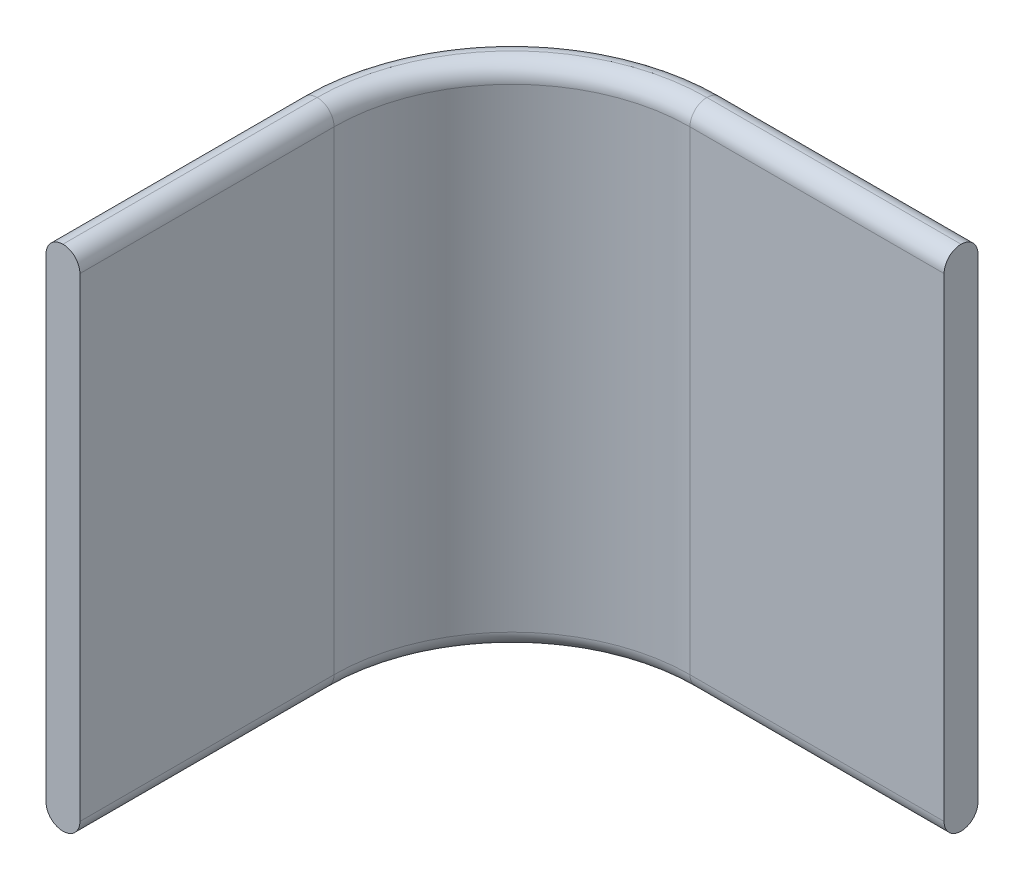
from build123d import *

# Parameters (mm, degrees)
BOSS_EXTRUDE1_DEPTH = 60
FILLET1_R           = 2


with BuildPart() as part:
    # Sketch1 → Boss-Extrude1 (new body)
    with BuildSketch(Plane(origin=(0, 0, 0), x_dir=(1, 0, 0), z_dir=(0, 1, 0))):
        with BuildLine():
            Line((-25, 0), (-25, -15))
            Line((-25, -15), (-25, -30))
            Line((-25, -30), (-21, -30))
            Line((-21, -30), (-21, -15))
            Line((-21, -15), (-21, 0))
            ThreePointArc((-21, 0), (-14.849242405, 14.849242405), (0, 21))
            Line((0, 21), (15, 21))
            Line((15, 21), (30, 21))
            Line((30, 21), (30, 25))
            Line((30, 25), (15, 25))
            Line((15, 25), (0, 25))
            ThreePointArc((0, 25), (-17.67766953, 17.67766953), (-25, 0))
        make_face()
    extrude(amount=BOSS_EXTRUDE1_DEPTH)

    # Fillet1
    fillet1_edges = [part.edges().sort_by_distance(p)[0] for p in [
        (15, 0, -25),
        (-25, 0, 15),
        (-21, 0, 15),
        (15, 0, -21),
        (15, 60, -25),
        (-25, 60, 15),
        (-21, 60, 15),
        (15, 60, -21),
        (-17.67766953, 0, -17.67766953),
        (-14.849242405, 0, -14.849242405),
        (-17.67766953, 60, -17.67766953),
        (-14.849242405, 60, -14.849242405),
    ]]
    fillet(fillet1_edges, radius=FILLET1_R - 0.0001)  # a hair under: the kernel refuses the full size


solid = part.part
